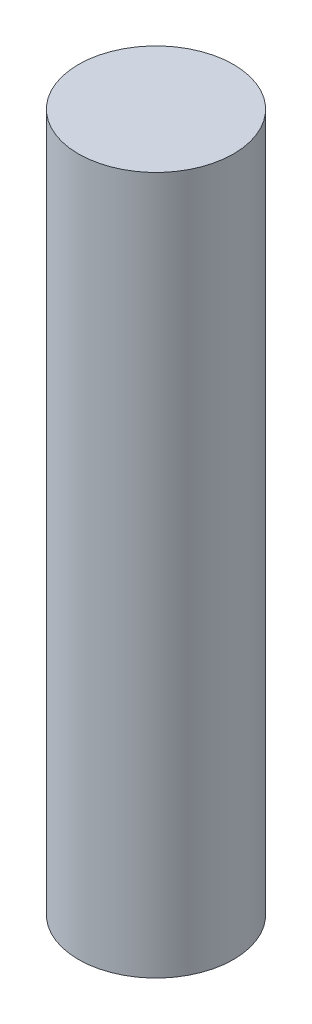
from build123d import *

# Parameters (mm, degrees)
SKETCH1_W = 2
SKETCH1_H = 18


with BuildPart() as part:
    # Sketch1 → Revolve1 (revolve)
    with BuildSketch(Plane.XY):
        with Locations((-1, 9)):
            Rectangle(SKETCH1_W, SKETCH1_H)
    revolve(axis=Axis((0, 0, 0), (0, 1, 0)))


solid = part.part
